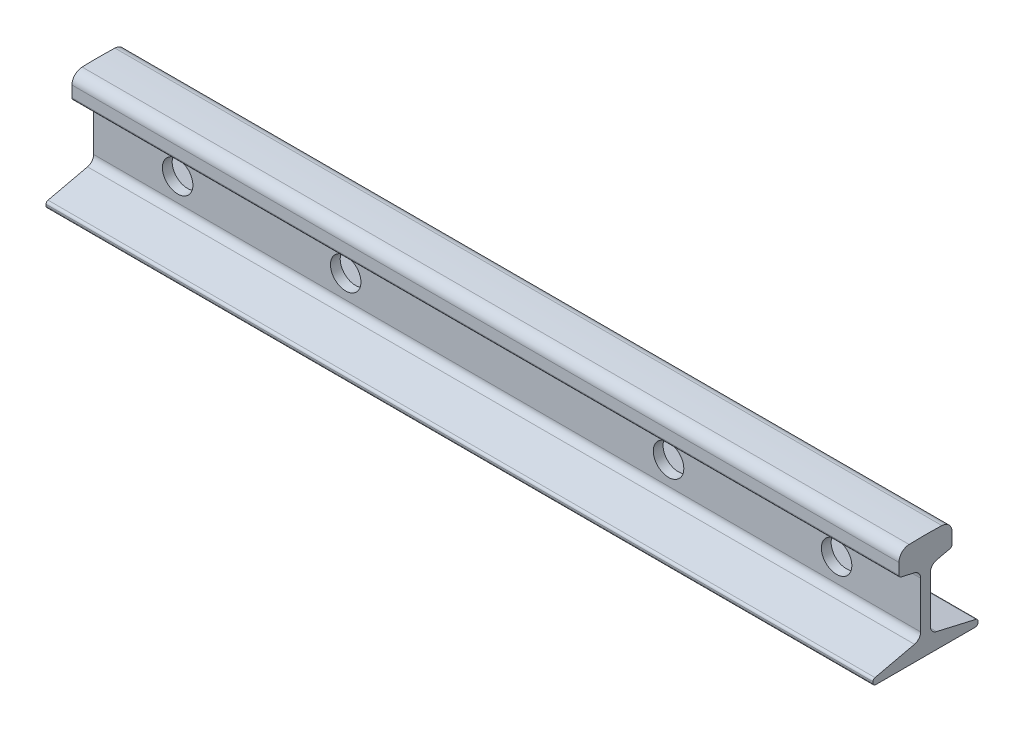
from build123d import *

# Parameters (mm, degrees)
BASE_DEPTH         = 500
FILLET1_R          = 6.35
FILLET2_R          = 4.76
FILLET3_R          = 1.59
SKETCH2_R          = 9.217255476
CUT_EXTRUDE1_DEPTH = 424.659690442


with BuildPart() as part:
    # Sketch1 → Base (new body)
    with BuildSketch(Plane(origin=(0, 0, 0), x_dir=(0, 0, -1), z_dir=(1, 0, 0))):
        with BuildLine():
            Line((16.05, 63.077130383), (16.05, 49.044373304))
            Line((16.05, 49.044373304), (2.95, 46.02))
            Line((2.95, 46.02), (2.95, 10.3))
            Line((2.95, 10.3), (31.75, 3.650996096))
            Line((31.75, 3.650996096), (31.75, 0))
            Line((31.75, 0), (-31.75, 0))
            Line((-31.75, 0), (-31.75, 3.650996096))
            Line((-31.75, 3.650996096), (-2.95, 10.3))
            Line((-2.95, 10.3), (-2.95, 46.02))
            Line((-2.95, 46.02), (-16.05, 49.044373304))
            Line((-16.05, 49.044373304), (-16.05, 63.077130383))
            ThreePointArc((-16.05, 63.077130383), (0, 63.5), (16.05, 63.077130383))
        make_face()
    extrude(amount=BASE_DEPTH)

    # Fillet1
    fillet1_edges = [part.edges().sort_by_distance(p)[0] for p in [
        (250, 63.077130383, -16.05),
        (250, 63.077130383, 16.05),
    ]]
    fillet(fillet1_edges, radius=FILLET1_R)

    # Fillet2
    fillet2_edges = [part.edges().sort_by_distance(p)[0] for p in [
        (250, 46.02, -2.95),
        (250, 10.3, -2.95),
        (250, 46.02, 2.95),
        (250, 10.3, 2.95),
    ]]
    fillet(fillet2_edges, radius=FILLET2_R)

    # Fillet3
    fillet3_edges = [part.edges().sort_by_distance(p)[0] for p in [
        (250, 49.044373304, 16.05),
        (250, 0, -31.75),
        (250, 3.650996096, -31.75),
        (250, 0, 31.75),
        (250, 3.650996096, 31.75),
        (250, 49.044373304, -16.05),
    ]]
    fillet(fillet3_edges, radius=FILLET3_R)

    # Sketch2 → Cut-Extrude1 (cut, through all)
    with BuildSketch(Plane(origin=(416.890903054, -3.473265232, 2.95), x_dir=(1, 0, 0), z_dir=(0, 0, 1))):
        with Locations((-366.094535074, 31.472237749)):
            Circle(SKETCH2_R)
        with Locations((-264.494535074, 31.472237749)):
            Circle(SKETCH2_R)
        with Locations((-69.287271034, 31.472237749)):
            Circle(SKETCH2_R)
        with Locations((32.312728966, 31.472237749)):
            Circle(SKETCH2_R)
    extrude(amount=-CUT_EXTRUDE1_DEPTH, mode=Mode.SUBTRACT)


solid = part.part
